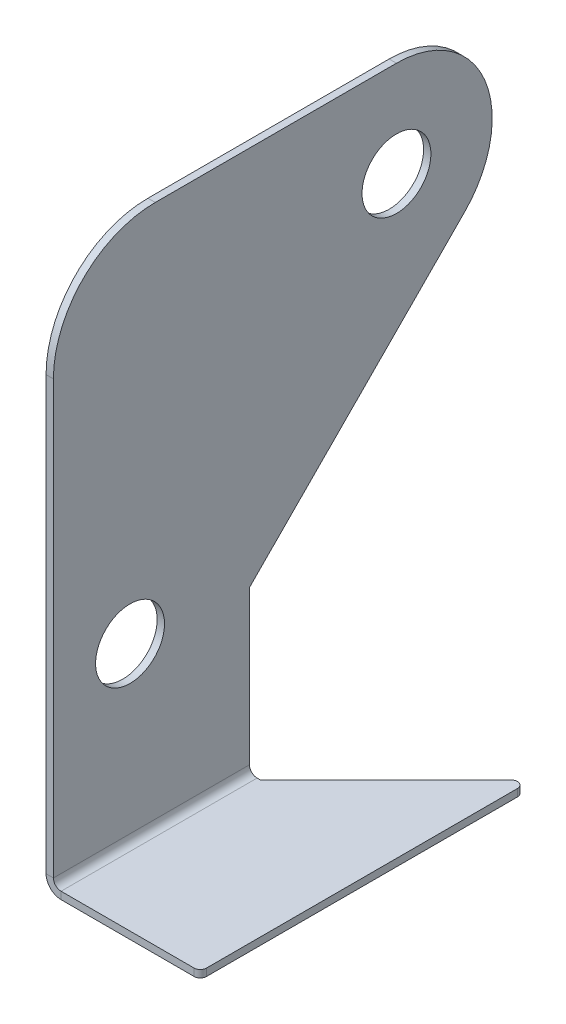
from build123d import *

# Parameters (mm, degrees)
SKETCH2_R              = 14.2875
SKETCH2_W              = 81.28
SKETCH2_H              = 3.175
BOSS_EXTRUDE1_DEPTH    = 3.175
SKETCH9_R              = 14.2875
CUT_EXTRUDE2_DEPTH     = 3.175
BOSS_EXTRUDE2_START    = 3.175
SKETCH2_3_W            = 81.28
SKETCH2_3_H            = 3.175
BOSS_EXTRUDE2_DEPTH    = 60.7695
BOSS_EXTRUDE3_DEPTH    = 3.175
FILLET1_R              = 2.54
FILLET2_R              = 42.2275
CONVERT_SOLID2_START   = -100.6475
CONVERT_SOLID2_DEPTH   = 181.9275
CONVERT_SOLID2_2_DEPTH = 81.28


# Read off the part's stored shape, not the designer's step: Convert-Solid2
with BuildPart() as part:
    # Sketch2 → Boss-Extrude1 (new body)
    # profile 1 of 2: a face of its own
    with BuildSketch(Plane(origin=(0, 0, 0), x_dir=(0, 0, -1), z_dir=(1, 0, 0))):
        with BuildLine():
            Line((0, 3.175), (0, 69.85))
            Line((0, 69.85), (89.183866464, 160.063269699))
            ThreePointArc((89.183866464, 160.063269699), (97.582743975, 203.257963311), (60.96, 227.65258))
            Line((60.96, 227.65258), (-81.28, 227.65258))
            Line((-81.28, 227.65258), (-81.28, 69.85))
            Line((-81.28, 69.85), (-81.28, 3.175))
            Line((-81.28, 3.175), (0, 3.175))
        make_face()
        with Locations((60.96, 187.96508)):
            Circle(SKETCH2_R, mode=Mode.SUBTRACT)
    # profile 2 of 2: a face of its own
    with BuildSketch(Plane(origin=(0, 0, 0), x_dir=(0, 0, -1), z_dir=(1, 0, 0))):
        with Locations((-40.64, 1.5875)):
            Rectangle(SKETCH2_W, SKETCH2_H)
    extrude(amount=BOSS_EXTRUDE1_DEPTH)

    # Sketch9 → Cut-Extrude2 (cut)
    with BuildSketch(Plane(origin=(0, 0, 0), x_dir=(0, 0, -1), z_dir=(1, 0, 0))):
        with Locations((-49.5046, 74.46228868)):
            Circle(SKETCH9_R)
    extrude(amount=CUT_EXTRUDE2_DEPTH, mode=Mode.SUBTRACT)

    # Sketch2<3> → Boss-Extrude2 (add)
    with BuildSketch(Plane(origin=(0, 0, 0), x_dir=(0, 0, -1), z_dir=(1, 0, 0)).offset(BOSS_EXTRUDE2_START)):
        with Locations((-40.64, 1.5875)):
            Rectangle(SKETCH2_3_W, SKETCH2_3_H)
    extrude(amount=BOSS_EXTRUDE2_DEPTH)

    # Sketch3 → Boss-Extrude3 (add)
    with BuildSketch(Plane(origin=(0, 3.175, 0), x_dir=(1, 0, 0), z_dir=(0, 1, 0))):
        Polygon((63.9445, 0), (63.9445, 56.3245), (7.62, 0), align=None)
    extrude(amount=-BOSS_EXTRUDE3_DEPTH)

    # Fillet1
    fillet1_edges = [part.edges().sort_by_distance(p)[0] for p in [
        (63.9445, 1.5875, 81.28),
        (63.9445, 1.5875, -56.3245),
    ]]
    fillet(fillet1_edges, radius=FILLET1_R)

    # Fillet2
    fillet2_edges = [part.edges().sort_by_distance(p)[0] for p in [
        (1.5875, 227.65258, 81.28),
    ]]
    fillet(fillet2_edges, radius=FILLET2_R)

    # Convert-Solid2 outline → Convert-Solid2 (cut)
    with BuildSketch(Plane.XY.offset(CONVERT_SOLID2_START)):
        with BuildLine():
            Line((0, 0), (6.21284, 0))
            ThreePointArc((6.21284, 0), (1.819698706, 1.819698706), (0, 6.21284))
            Line((0, 6.21284), (0, 0))
        make_face()
        with BuildLine():
            Line((6.21284, 3.03784), (63.9445, 3.03784))
            Line((63.9445, 3.03784), (63.9445, 3.175))
            Line((63.9445, 3.175), (5.289718593, 3.175))
            ThreePointArc((5.289718593, 3.175), (5.746212204, 3.072317193), (6.21284, 3.03784))
        make_face()
        with BuildLine():
            Line((3.175, 227.65258), (3.03784, 227.65258))
            Line((3.03784, 227.65258), (3.03784, 6.21284))
            ThreePointArc((3.03784, 6.21284), (3.072317193, 5.746212204), (3.175, 5.289718593))
            Line((3.175, 5.289718593), (3.175, 227.65258))
        make_face()
    extrude(amount=CONVERT_SOLID2_DEPTH, mode=Mode.SUBTRACT)

    # Convert-Solid2 2 outline → Convert-Solid2 2 (add)
    with BuildSketch(Plane.XY):
        with BuildLine():
            Line((3.175, 3.175), (5.289718593, 3.175))
            ThreePointArc((5.289718593, 3.175), (3.96777597, 3.96777597), (3.175, 5.289718593))
            Line((3.175, 5.289718593), (3.175, 3.175))
        make_face()
    extrude(amount=CONVERT_SOLID2_2_DEPTH)


solid = part.part
